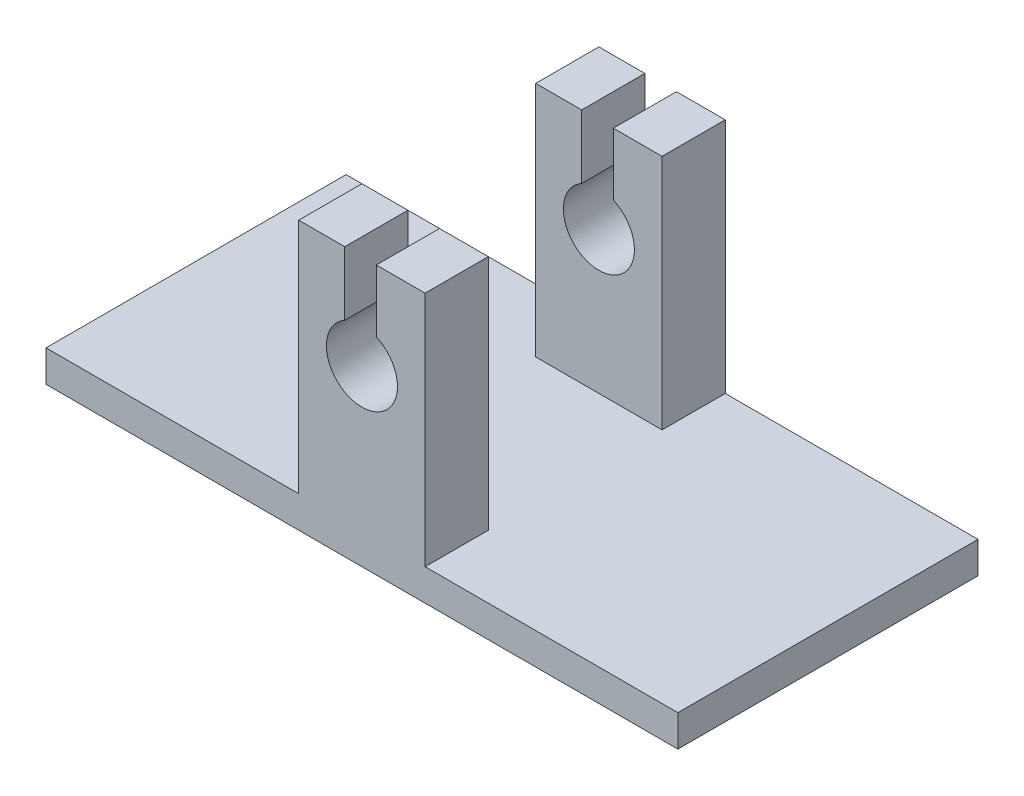
from build123d import *

# Parameters (mm, degrees)
SKETCH2_W           = 254
SKETCH2_H           = 120.65
BOSS_EXTRUDE2_DEPTH = 12.7
SKETCH4_W           = 50.8
SKETCH4_H           = 25.4
BOSS_EXTRUDE3_DEPTH = 95.25
CUT_EXTRUDE1_DEPTH  = 206.763517174


with BuildPart() as part:
    # Sketch2 → Boss-Extrude2 (new body)
    with BuildSketch(Plane(origin=(0, 0, 0), x_dir=(1, 0, 0), z_dir=(0, 1, 0))):
        Rectangle(SKETCH2_W, SKETCH2_H)
    extrude(amount=BOSS_EXTRUDE2_DEPTH)

    # Sketch4 → Boss-Extrude3 (add)
    with BuildSketch(Plane(origin=(0, 12.7, 0), x_dir=(1, 0, 0), z_dir=(0, 1, 0))):
        with Locations((0, -47.625)):
            Rectangle(SKETCH4_W, SKETCH4_H)
    boss_extrude3 = extrude(amount=BOSS_EXTRUDE3_DEPTH)

    # Mirror1: Boss-Extrude3 across plane
    add(boss_extrude3.mirror(Plane.XY))

    # Sketch6 → Cut-Extrude1 (cut, through all)
    with BuildSketch(Plane.XY.offset(60.325)):
        with BuildLine():
            Line((-6.911847883, 107.95), (5.788152117, 107.95))
            Line((5.788152117, 107.95), (5.788152117, 82.912540003))
            ThreePointArc((5.788152117, 82.912540003), (0.627347046, 55.576279674), (-6.911847883, 82.354359843))
            Line((-6.911847883, 82.354359843), (-6.911847883, 107.95))
        make_face()
    extrude(amount=-CUT_EXTRUDE1_DEPTH, mode=Mode.SUBTRACT)


solid = part.part
